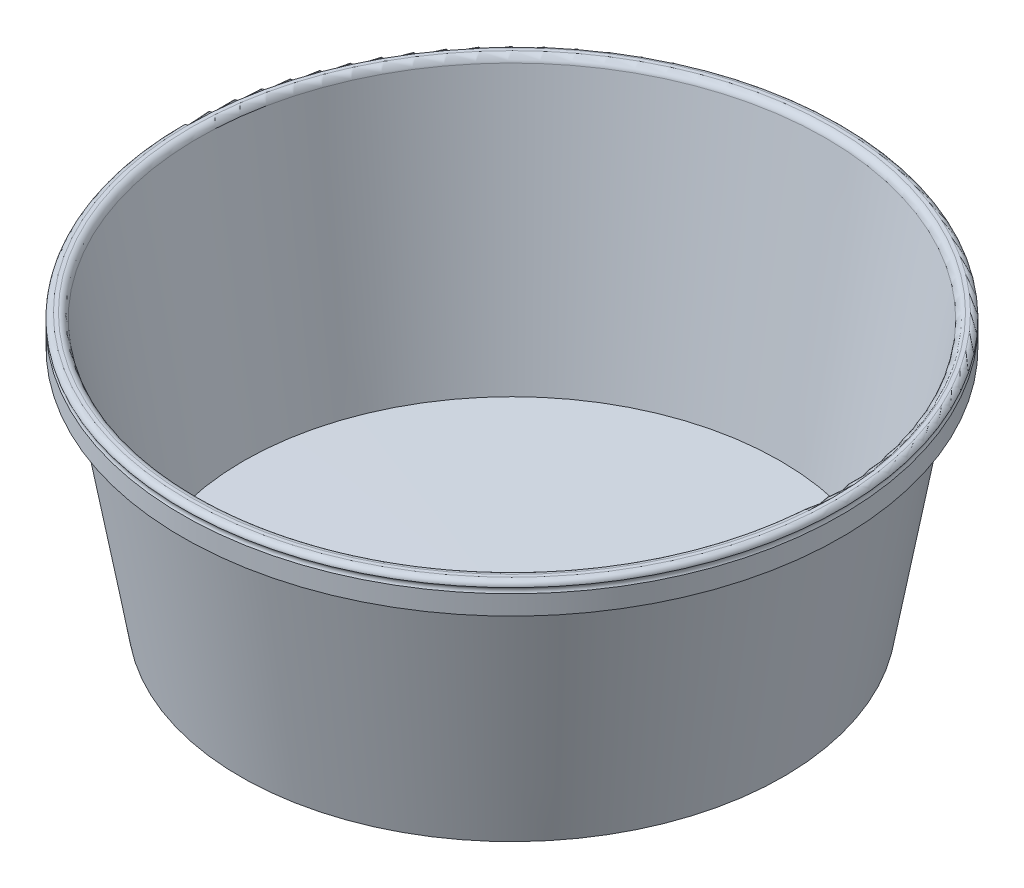
from build123d import *

# Parameters (mm, degrees)
SALIENTE_EXTRUIR1_DEPTH = 0.5
MATRIZC1_COUNT          = 3


with BuildPart() as part:
    # Croquis1 → Revolución1 (revolve)
    with BuildSketch(Plane.XY):
        with BuildLine():
            Line((77, -1.344039999), (90, 72.382623656))
            ThreePointArc((90, 72.382623656), (90.342020143, 72.975019921), (90.984807753, 73.208975478))
            Line((90.984807753, 73.208975478), (91.984807753, 73.208975478))
            ThreePointArc((91.984807753, 73.208975478), (92.338361144, 73.062528868), (92.484807753, 72.708975478))
            Line((92.484807753, 72.708975478), (92.484807753, 65.708975478))
            Line((92.484807753, 65.708975478), (93.485934673, 65.708975478))
            Line((93.485934673, 65.708975478), (93.485934673, 71.208975478))
            ThreePointArc((93.485934673, 71.208975478), (93.235101647, 71.958975478), (93.485934673, 72.708975478))
            ThreePointArc((93.485934673, 72.708975478), (93.046594845, 73.76963565), (91.985934673, 74.208975478))
            Line((91.985934673, 74.208975478), (90.985934673, 74.208975478))
            ThreePointArc((90.985934673, 74.208975478), (89.700359454, 73.741064364), (89.016319167, 72.556271833))
            Line((89.016319167, 72.556271833), (76.164625264, -0.329306151))
            Line((76.164625264, -0.329306151), (2, 0.965242198))
            ThreePointArc((2, 0.965242198), (1.125913375, 1.725988918), (0, 2))
            Line((0, 2), (0, 0))
            Line((0, 0), (77, -1.344039999))
        make_face()
    revolve(axis=Axis((0, 0, 0), (0, 1, 0)))

    # Croquis2 → Saliente-Extruir1 (add, symmetric)
    with BuildSketch(Plane.XY):
        with BuildLine():
            Line((88.131569783, 61.843817038), (90.068994608, 72.831499224))
            ThreePointArc((90.068994608, 72.831499224), (90.136370503, 73.028611856), (90.240590773, 73.208975478))
            Line((90.240590773, 73.208975478), (91.984807753, 73.208975478))
            ThreePointArc((91.984807753, 73.208975478), (92.338361144, 73.062528868), (92.484807753, 72.708975478))
            Line((92.484807753, 72.708975478), (92.484807753, 66.844599982))
            ThreePointArc((92.484807753, 66.844599982), (89.758128277, 64.823042372), (88.131569783, 61.843817038))
        make_face()
    saliente_extruir1 = extrude(amount=SALIENTE_EXTRUIR1_DEPTH, both=True)

    # MatrizC1: Saliente-Extruir1 ×3 about axis
    matrizc1_axis = Axis((0, -0.329306151, 0), (0, -1, 0))
    for i in range(1, MATRIZC1_COUNT):
        add(saliente_extruir1.rotate(matrizc1_axis, i * 360 / MATRIZC1_COUNT))


solid = part.part
